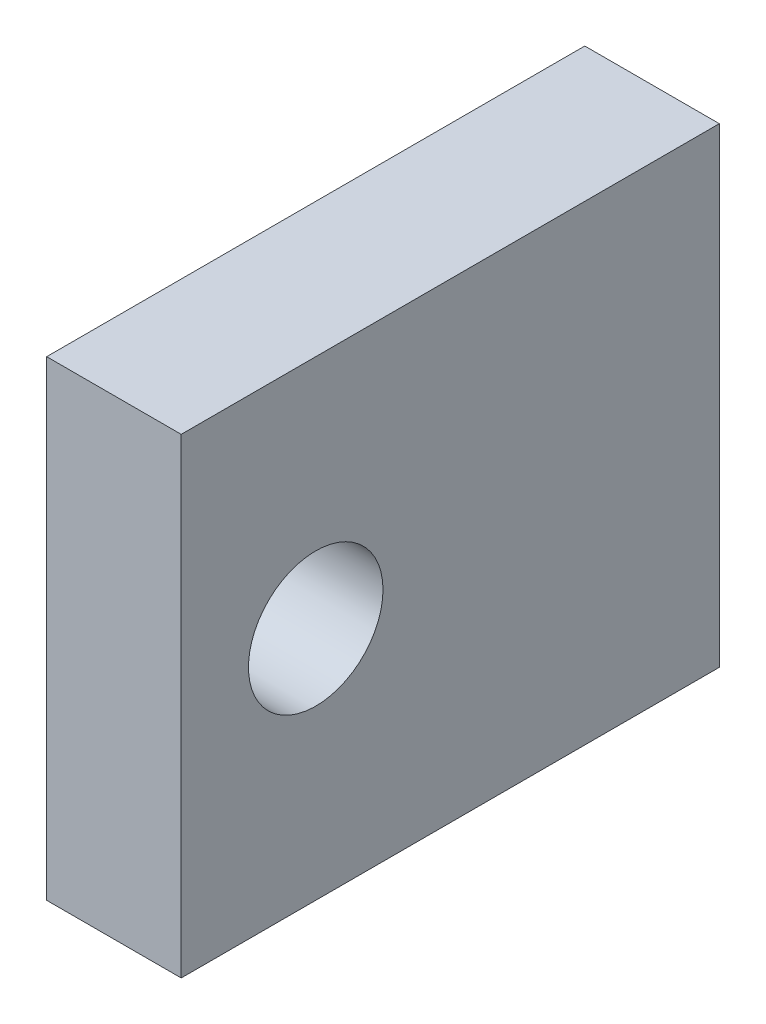
from build123d import *

# Parameters (mm, degrees)
SKETCH1_W           = 50.8
SKETCH1_H           = 44.45
SKETCH1_R           = 6.35
BOSS_EXTRUDE1_DEPTH = 12.7


with BuildPart() as part:
    # Sketch1 → Boss-Extrude1 (new body)
    with BuildSketch(Plane(origin=(0, 0, 0), x_dir=(0, 0, -1), z_dir=(1, 0, 0))):
        Rectangle(SKETCH1_W, SKETCH1_H)
        with Locations((-12.7, 0)):
            Circle(SKETCH1_R, mode=Mode.SUBTRACT)
    extrude(amount=BOSS_EXTRUDE1_DEPTH)


solid = part.part
